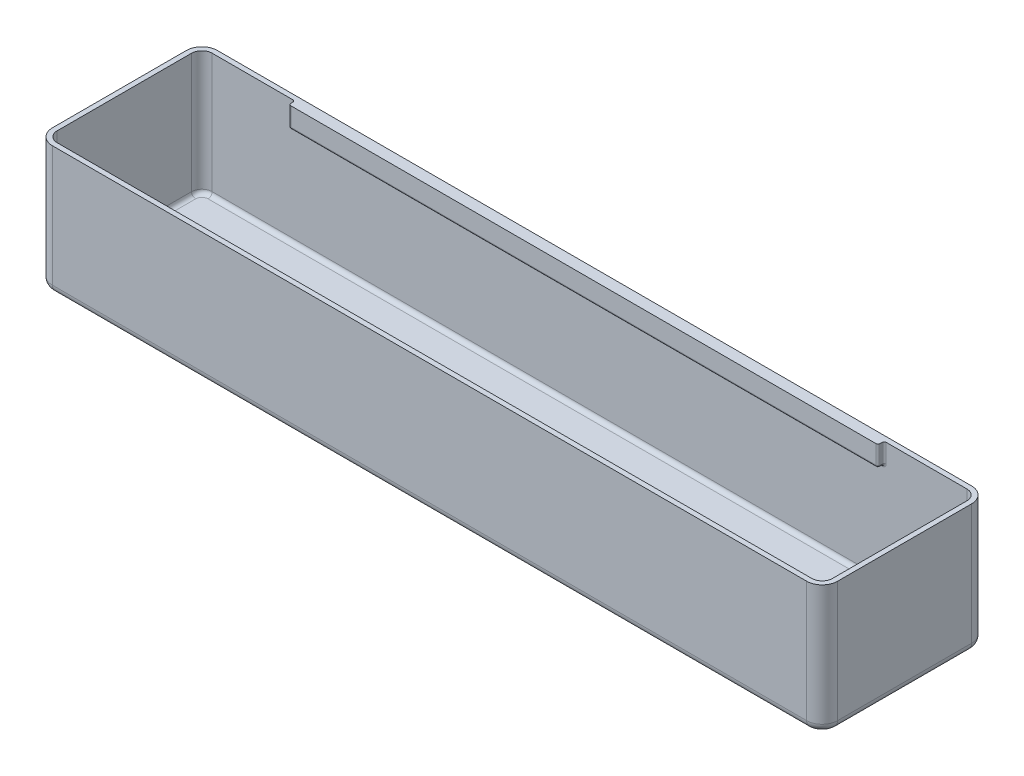
from build123d import *

# Parameters (mm, degrees)
SKETCH1_W           = 241.173
SKETCH1_H           = 50.673
SKETCH1_W_2         = 238.125
SKETCH1_H_2         = 47.625
BOSS_EXTRUDE1_DEPTH = 38.1
SKETCH2_W           = 241.173
SKETCH2_H           = 50.673
BOSS_EXTRUDE2_DEPTH = 1.524
FILLET1_R           = 3.175
FILLET2_R           = 4.7625
SKETCH4_R           = 12.065
CUT_EXTRUDE2_DEPTH  = 130.433780716
SKETCH5_W           = 180.975
SKETCH5_H           = 6.35
BOSS_EXTRUDE3_DEPTH = 1.905
FILLET3_R           = 0.635
FILLET4_R           = 1.27
FILLET5_R           = 2.54


with BuildPart() as part:
    # Sketch1 → Boss-Extrude1 (new body)
    with BuildSketch(Plane(origin=(0, 0, 0), x_dir=(1, 0, 0), z_dir=(0, 1, 0))):
        Rectangle(SKETCH1_W, SKETCH1_H)
        Rectangle(SKETCH1_W_2, SKETCH1_H_2, mode=Mode.SUBTRACT)
    extrude(amount=BOSS_EXTRUDE1_DEPTH)

    # Sketch2 → Boss-Extrude2 (add)
    with BuildSketch(Plane.XZ):
        Rectangle(SKETCH2_W, SKETCH2_H)
        with BuildLine():
            ThreePointArc((104.3365, 1.0115), (106.4365, 3.1115), (104.3365, 5.2115))
            ThreePointArc((104.3365, 5.2115), (102.2365, 3.1115), (104.3365, 1.0115))
        make_face(mode=Mode.SUBTRACT)
        with BuildLine():
            ThreePointArc((73.3365, 1.0115), (75.4365, 3.1115), (73.3365, 5.2115))
            ThreePointArc((73.3365, 5.2115), (71.2365, 3.1115), (73.3365, 1.0115))
        make_face(mode=Mode.SUBTRACT)
    extrude(amount=BOSS_EXTRUDE2_DEPTH)

    # Fillet1
    fillet1_edges = [part.edges().sort_by_distance(p)[0] for p in [
        (119.0625, 19.05, -23.8125),
        (119.0625, 19.05, 23.8125),
        (-119.0625, 19.05, 23.8125),
        (-119.0625, 19.05, -23.8125),
    ]]
    fillet(fillet1_edges, radius=FILLET1_R)

    # Fillet2
    fillet2_edges = [part.edges().sort_by_distance(p)[0] for p in [
        (-120.5865, 18.288, -25.3365),
        (120.5865, 18.288, -25.3365),
        (120.5865, 18.288, 25.3365),
        (-120.5865, 18.288, 25.3365),
    ]]
    fillet(fillet2_edges, radius=FILLET2_R)

    # Sketch4 → Cut-Extrude2 (cut, through all)
    with BuildSketch(Plane.XZ.offset(1.524)):
        with Locations((88.8365, 3.1115)):
            Circle(SKETCH4_R)
    extrude(amount=-CUT_EXTRUDE2_DEPTH, mode=Mode.SUBTRACT)

    # Sketch5 → Boss-Extrude3 (add)
    with BuildSketch(Plane.XY.offset(-23.8125)):
        with Locations((0, 34.925)):
            Rectangle(SKETCH5_W, SKETCH5_H)
    extrude(amount=BOSS_EXTRUDE3_DEPTH)

    # Fillet3
    fillet3_edges = [part.edges().sort_by_distance(p)[0] for p in [
        (0, 31.75, -21.9075),
        (0, 31.75, -23.8125),
        (-90.4875, 34.925, -23.8125),
        (-90.4875, 34.925, -21.9075),
        (90.4875, 34.925, -21.9075),
        (90.4875, 34.925, -23.8125),
        (-90.4875, 31.75, -22.86),
        (90.4875, 31.75, -22.86),
    ]]
    fillet(fillet3_edges, radius=FILLET3_R)

    # Fillet4
    fillet4_edges = [part.edges().sort_by_distance(p)[0] for p in [
        (118.13256403, 0, -22.88256403),
        (119.0625, 0, 0),
        (118.13256403, 0, 22.88256403),
        (0, 0, 23.8125),
        (-118.13256403, 0, 22.88256403),
        (-119.0625, 0, 0),
        (-118.13256403, 0, -22.88256403),
        (0, 0, -23.8125),
    ]]
    fillet(fillet4_edges, radius=FILLET4_R)

    # Fillet5
    fillet5_edges = [part.edges().sort_by_distance(p)[0] for p in [
        (-119.191596045, -1.524, 23.941596045),
        (0, -1.524, 25.3365),
        (119.191596045, -1.524, 23.941596045),
        (120.5865, -1.524, 0),
        (119.191596045, -1.524, -23.941596045),
        (0, -1.524, -25.3365),
        (-119.191596045, -1.524, -23.941596045),
        (-120.5865, -1.524, 0),
    ]]
    fillet(fillet5_edges, radius=FILLET5_R)


solid = part.part
